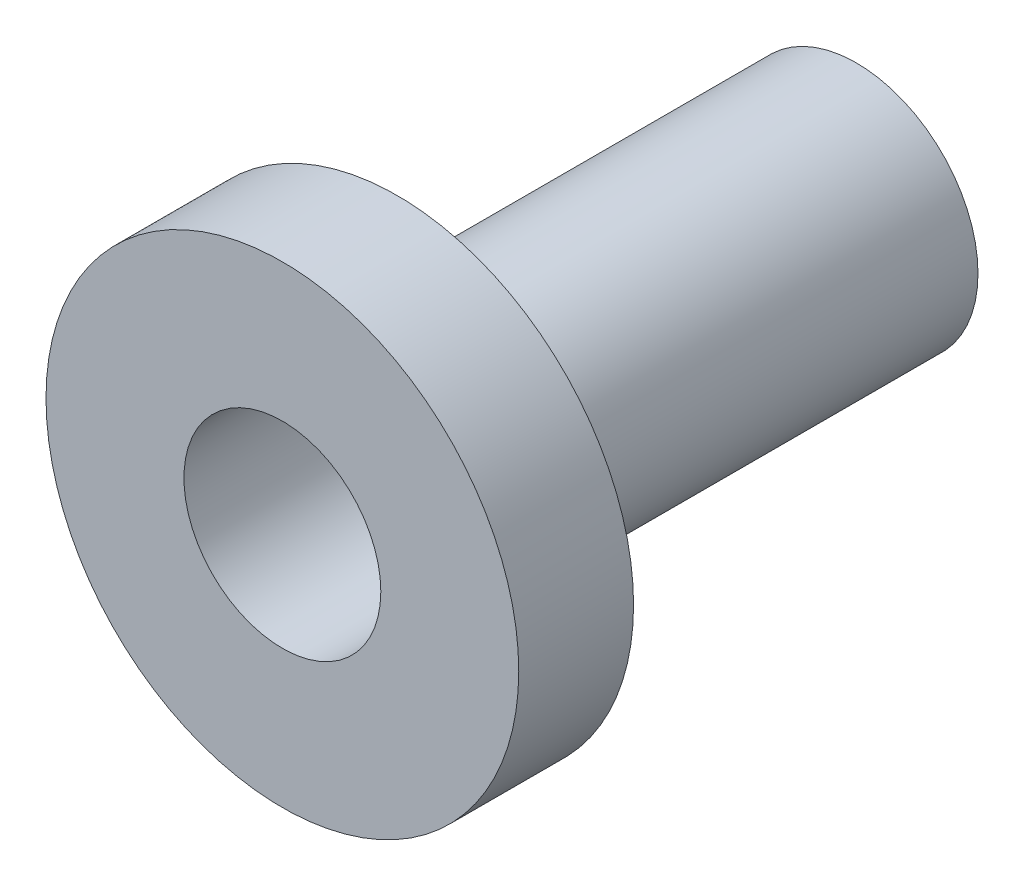
from build123d import *

# Parameters (mm, degrees)
SKETCH1_R           = 18
BOSS_EXTRUDE1_DEPTH = 85
SKETCH2_R           = 14.576002813
CUT_EXTRUDE1_DEPTH  = 60
SKETCH3_R           = 4.364419647
CUT_EXTRUDE2_DEPTH  = 60
SKETCH4_R           = 35
SKETCH4_R_2         = 14.576002813
BOSS_EXTRUDE2_DEPTH = 17


with BuildPart() as part:
    # Sketch1 → Boss-Extrude1 (new body)
    with BuildSketch(Plane.XY):
        Circle(SKETCH1_R)
    extrude(amount=BOSS_EXTRUDE1_DEPTH)

    # Sketch2 → Cut-Extrude1 (cut)
    with BuildSketch(Plane.XY.offset(85)):
        Circle(SKETCH2_R)
    extrude(amount=-CUT_EXTRUDE1_DEPTH, mode=Mode.SUBTRACT)

    # Sketch3 → Cut-Extrude2 (cut)
    with BuildSketch(Plane(origin=(0, 0, 0), x_dir=(-1, 0, 0), z_dir=(0, 0, -1))):
        Circle(SKETCH3_R)
    extrude(amount=-CUT_EXTRUDE2_DEPTH, mode=Mode.SUBTRACT)

    # Sketch4 → Boss-Extrude2 (add)
    with BuildSketch(Plane.XY.offset(85)):
        Circle(SKETCH4_R)
        Circle(SKETCH4_R_2, mode=Mode.SUBTRACT)
    extrude(amount=-BOSS_EXTRUDE2_DEPTH)


solid = part.part
